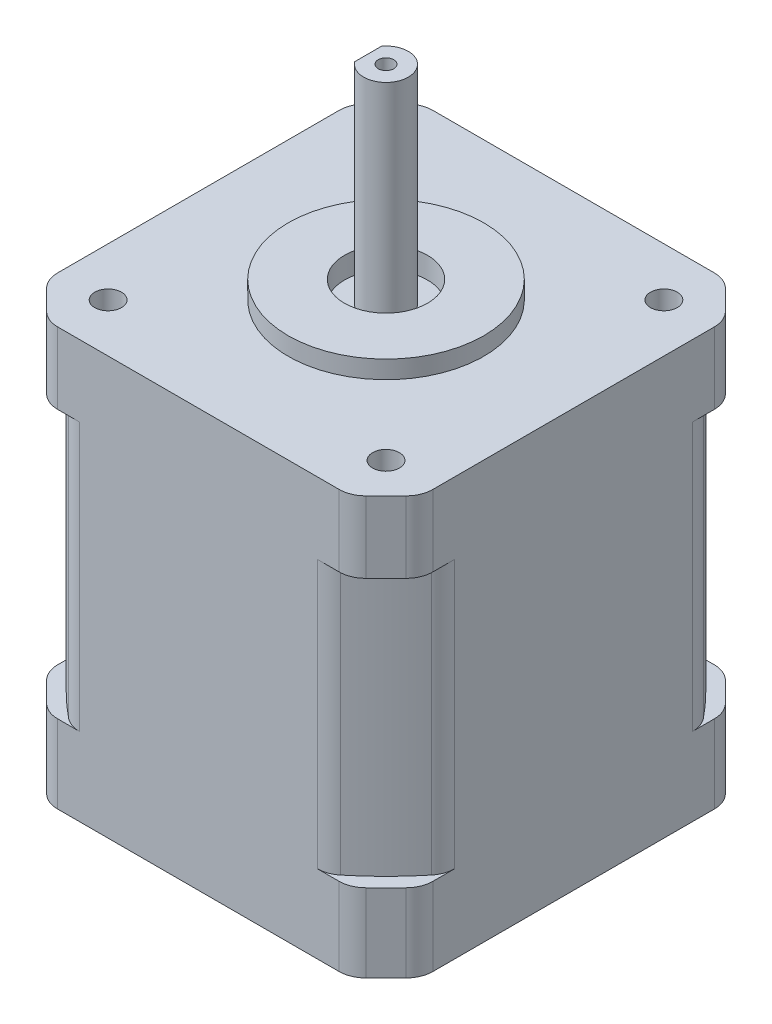
from build123d import *

# Parameters (mm, degrees)
SKETCH1_W             = 42
SKETCH1_H             = 42
SKETCH1_R             = 3.407851421
BOSS_EXTRUDE1_DEPTH   = 46.75
SKETCH2_R             = 10.95
BOSS_EXTRUDE2_DEPTH   = 2
CUT_EXTRUDE1_START    = -8
CUT_EXTRUDE1_DEPTH    = 30
CIRPATTERN1_COUNT     = 4
FILLET1_R             = 3
CHAMFER1_SIZE         = 4
FILLET2_R             = 3
SKETCH4_R             = 4.65
CUT_EXTRUDE2_DEPTH    = 2.4
DELETEFACE1_OUTLINE_R = 3.407851421
DELETEFACE1_DEPTH     = 46.35
SKETCH5_R             = 2.5
BOSS_EXTRUDE3_DEPTH   = 23.25
CUT_EXTRUDE3_DEPTH    = 15.25
SKETCH7_R             = 0.875
CUT_EXTRUDE4_DEPTH    = 2
SKETCH8_R             = 1.5
CUT_EXTRUDE5_DEPTH    = 5


# Read off the part's stored shape, not the designer's step: DeleteFace1
with BuildPart() as part:
    # Sketch1 → Boss-Extrude1 (new body)
    with BuildSketch(Plane(origin=(0, 0, 0), x_dir=(1, 0, 0), z_dir=(0, 1, 0))):
        Rectangle(SKETCH1_W, SKETCH1_H)
        with Locations(Location((0, 0, 0), (0, 0, 270))):
            Circle(SKETCH1_R, mode=Mode.SUBTRACT)
    extrude(amount=BOSS_EXTRUDE1_DEPTH)

    # Sketch2 → Boss-Extrude2 (add)
    with BuildSketch(Plane(origin=(0, 46.75, 0), x_dir=(1, 0, 0), z_dir=(0, 1, 0))):
        with Locations(Location((0, 0, 0), (0, 0, 90))):
            Circle(SKETCH2_R)
    extrude(amount=BOSS_EXTRUDE2_DEPTH)

    # Sketch3 → Cut-Extrude1 (cut)
    with BuildSketch(Plane(origin=(0, 46.75, 0), x_dir=(1, 0, 0), z_dir=(0, 1, 0)).offset(CUT_EXTRUDE1_START)):
        with BuildLine():
            Line((-14.355339059, 21), (-21, 21))
            Line((-21, 21), (-21, 14.355339059))
            ThreePointArc((-21, 14.355339059), (-17.901682199, 17.901682199), (-14.355339059, 21))
        make_face()
    cut_extrude1 = extrude(amount=-CUT_EXTRUDE1_DEPTH, mode=Mode.SUBTRACT)

    # CirPattern1: Cut-Extrude1 ×4 about axis
    cirpattern1_axis = Axis((0, 0, 0), (0, 1, 0))
    for i in range(1, CIRPATTERN1_COUNT):
        add(cut_extrude1.rotate(cirpattern1_axis, i * 360 / CIRPATTERN1_COUNT), mode=Mode.SUBTRACT)

    # Fillet1
    fillet1_edges = [part.edges().sort_by_distance(p)[0] for p in [
        (-14.355339059, 23.75, -21),
        (-21, 23.75, -14.355339059),
        (21, 23.75, -14.355339059),
        (14.355339059, 23.75, -21),
        (14.355339059, 23.75, 21),
        (21, 23.75, 14.355339059),
        (-21, 23.75, 14.355339059),
        (-14.355339059, 23.75, 21),
    ]]
    fillet(fillet1_edges, radius=FILLET1_R)

    # Chamfer1
    chamfer1_edges = [part.edges().sort_by_distance(p)[0] for p in [
        (-21, 4.375, -21),
        (21, 4.375, -21),
        (21, 4.375, 21),
        (-21, 4.375, 21),
        (-21, 42.75, -21),
        (-21, 42.75, 21),
        (21, 42.75, 21),
        (21, 42.75, -21),
    ]]
    chamfer(chamfer1_edges, length=CHAMFER1_SIZE)

    # Fillet2
    fillet2_edges = [part.edges().sort_by_distance(p)[0] for p in [
        (17, 42.75, 21),
        (17, 4.375, 21),
        (-17, 4.375, 21),
        (-17, 42.75, 21),
        (-21, 42.75, -17),
        (-21, 4.375, -17),
        (-21, 4.375, 17),
        (-21, 42.75, 17),
        (17, 42.75, -21),
        (17, 4.375, -21),
        (-17, 42.75, -21),
        (-17, 4.375, -21),
        (21, 42.75, -17),
        (21, 4.375, -17),
        (21, 42.75, 17),
        (21, 4.375, 17),
    ]]
    fillet(fillet2_edges, radius=FILLET2_R)

    # Sketch4 → Cut-Extrude2 (cut)
    with BuildSketch(Plane(origin=(0, 48.75, 0), x_dir=(1, 0, 0), z_dir=(0, 1, 0))):
        with Locations(Location((0, 0, 0), (0, 0, 270))):
            Circle(SKETCH4_R)
    extrude(amount=-CUT_EXTRUDE2_DEPTH, mode=Mode.SUBTRACT)

    # DeleteFace1 outline → DeleteFace1 (add)
    with BuildSketch(Plane(origin=(0, 0, 0), x_dir=(1, 0, 0), z_dir=(0, 1, 0))):
        Circle(DELETEFACE1_OUTLINE_R)
    extrude(amount=DELETEFACE1_DEPTH)

    # Sketch5 → Boss-Extrude3 (add)
    with BuildSketch(Plane(origin=(0, 46.35, 0), x_dir=(1, 0, 0), z_dir=(0, 1, 0))):
        with Locations(Location((0, 0, 0), (0, 0, 90))):
            Circle(SKETCH5_R)
    extrude(amount=BOSS_EXTRUDE3_DEPTH)

    # Sketch6 → Cut-Extrude3 (cut)
    with BuildSketch(Plane(origin=(0, 69.6, 0), x_dir=(1, 0, 0), z_dir=(0, 1, 0))):
        with BuildLine():
            Line((-2, 1.5), (-2, -1.5))
            ThreePointArc((-2, -1.5), (-10.750577437, 0), (-2, 1.5))
        make_face()
    extrude(amount=-CUT_EXTRUDE3_DEPTH, mode=Mode.SUBTRACT)

    # Sketch7 → Cut-Extrude4 (cut)
    with BuildSketch(Plane(origin=(0, 69.6, 0), x_dir=(1, 0, 0), z_dir=(0, 1, 0))):
        with Locations(Location((0, 0, 0), (0, 0, 270))):
            Circle(SKETCH7_R)
    extrude(amount=-CUT_EXTRUDE4_DEPTH, mode=Mode.SUBTRACT)

    # Sketch8 → Cut-Extrude5 (cut)
    with BuildSketch(Plane(origin=(0, 46.75, 0), x_dir=(1, 0, 0), z_dir=(0, 1, 0))):
        with Locations(Location((-15.556349186, 15.556349186, 0), (0, 0, 270))):
            Circle(SKETCH8_R)
        with Locations(Location((15.556349186, 15.556349186, 0), (0, 0, 270))):
            Circle(SKETCH8_R)
        with Locations(Location((15.556349186, -15.556349186, 0), (0, 0, 270))):
            Circle(SKETCH8_R)
        with Locations(Location((-15.556349186, -15.556349186, 0), (0, 0, 270))):
            Circle(SKETCH8_R)
    extrude(amount=-CUT_EXTRUDE5_DEPTH, mode=Mode.SUBTRACT)


solid = part.part
